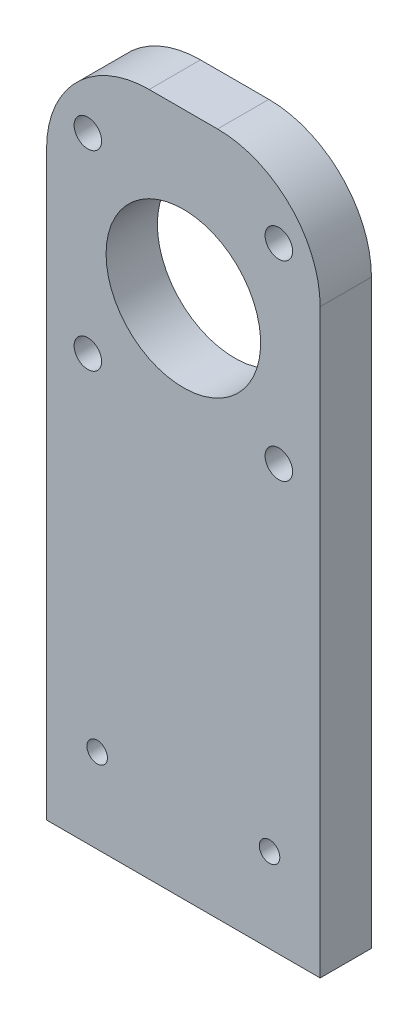
from build123d import *

# Parameters (mm, degrees)
SKETCH2_W           = 50.8
SKETCH2_H           = 127
SKETCH2_R           = 14.351
SKETCH2_R_2         = 2.5527
SKETCH2_R_3         = 1.905
BOSS_EXTRUDE3_DEPTH = 9.525
FILLET1_R           = 19.05
FILLET4_R           = 19.05


with BuildPart() as part:
    # Sketch2 → Boss-Extrude3 (new body)
    with BuildSketch(Plane.XY):
        with Locations((25.4, 63.5)):
            Rectangle(SKETCH2_W, SKETCH2_H)
        with Locations((25.4, 96.5708)):
            Circle(SKETCH2_R, mode=Mode.SUBTRACT)
        with Locations((43.1292, 114.3)):
            Circle(SKETCH2_R_2, mode=Mode.SUBTRACT)
        with Locations((7.6708, 114.3)):
            Circle(SKETCH2_R_2, mode=Mode.SUBTRACT)
        with Locations((7.6708, 78.8416)):
            Circle(SKETCH2_R_2, mode=Mode.SUBTRACT)
        with Locations((43.1292, 78.8416)):
            Circle(SKETCH2_R_2, mode=Mode.SUBTRACT)
        with Locations((41.4, 15.636322387)):
            Circle(SKETCH2_R_3, mode=Mode.SUBTRACT)
        with Locations((9.4, 15.636322387)):
            Circle(SKETCH2_R_3, mode=Mode.SUBTRACT)
    extrude(amount=BOSS_EXTRUDE3_DEPTH)

    # Fillet1
    fillet1_edges = [part.edges().sort_by_distance(p)[0] for p in [
        (50.8, 127, 4.7625),
    ]]
    fillet(fillet1_edges, radius=FILLET1_R)

    # Fillet4
    fillet4_edges = [part.edges().sort_by_distance(p)[0] for p in [
        (0, 127, 4.7625),
    ]]
    fillet(fillet4_edges, radius=FILLET4_R)


solid = part.part
